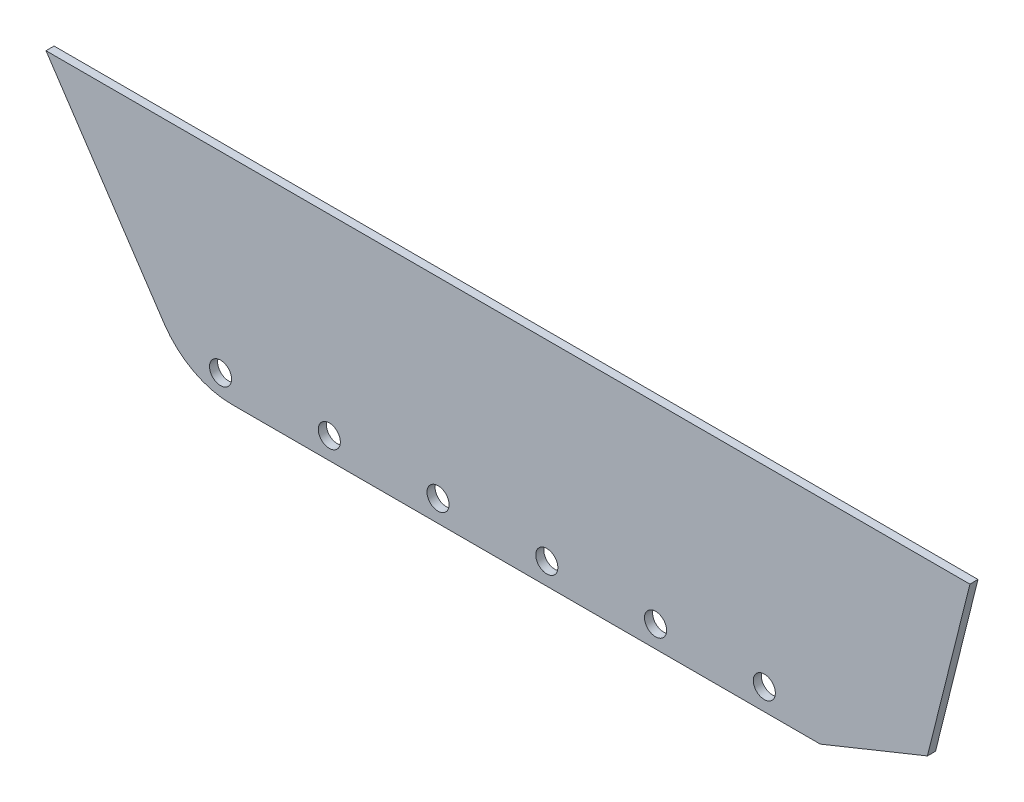
from build123d import *

# Parameters (mm, degrees)
BOSS_EXTRUDE1_DEPTH = 4.7625
SKETCH1_4_R         = 6.5
CUT_EXTRUDE1_DEPTH  = 439.920211962
FILLET1_R           = 48
CUT_EXTRUDE3_DEPTH  = 10


with BuildPart() as part:
    # Sketch1 → Boss-Extrude1 (new body)
    with BuildSketch(Plane.XY):
        Polygon((428.120588235, 28.939617947), (0.540381846, 28.939617947), (-115.605170134, 28.939617947), (-98.879411765, 3.850980392), (-31.879411765, -96.649019608), (366, -96.649019608), (403.120588235, -71.149019608), align=None)
    extrude(amount=BOSS_EXTRUDE1_DEPTH)

    # Sketch1<4> → Cut-Extrude1 (cut, through all)
    with BuildSketch(Plane.XY):
        with Locations((-12.879411765, -83.899019608)):
            Circle(SKETCH1_4_R)
        with Locations((51.120588235, -83.899019608)):
            Circle(SKETCH1_4_R)
        with Locations((115.120588235, -83.899019608)):
            Circle(SKETCH1_4_R)
        with Locations((179.120588235, -83.899019608)):
            Circle(SKETCH1_4_R)
        with Locations((243.120588235, -83.899019608)):
            Circle(SKETCH1_4_R)
        with Locations((307.120588235, -83.899019608)):
            Circle(SKETCH1_4_R)
    extrude(amount=CUT_EXTRUDE1_DEPTH, mode=Mode.SUBTRACT)

    # Fillet1
    fillet1_edges = [part.edges().sort_by_distance(p)[0] for p in [
        (-31.879411765, -96.649019608, 2.38125),
    ]]
    fillet(fillet1_edges, radius=FILLET1_R)

    # Sketch7 → Cut-Extrude3 (cut)
    with BuildSketch(Plane.XY.offset(4.7625)):
        Polygon((403.120588235, -71.149019608), (340.005873473, -96.649019608), (366, -96.649019608), align=None)
    extrude(amount=-CUT_EXTRUDE3_DEPTH, mode=Mode.SUBTRACT)


solid = part.part
